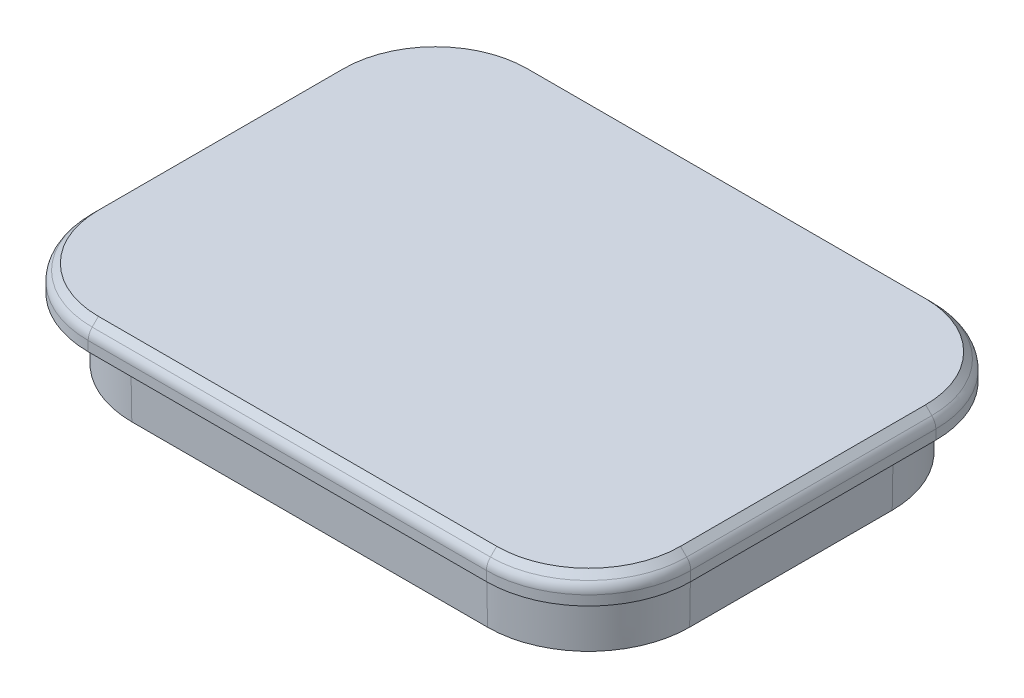
from build123d import *

# Parameters (mm, degrees)
BOSS_EXTRUDE1_DEPTH = 3.6
BOSS_EXTRUDE2_DEPTH = 1.5
CUT_EXTRUDE1_DEPTH  = 3.6
BOSS_EXTRUDE5_DEPTH = 3.6
CHAMFER1_SIZE       = 3.6
CHAMFER1_SIZE_2     = 0.062838234
FILLET3_R           = 1
CHAMFER2_SIZE       = 0.6
FILLET4_R           = 0.8


with BuildPart() as part:
    # Sketch1 → Boss-Extrude1 (new body)
    with BuildSketch(Plane(origin=(0, 0, 0), x_dir=(1, 0, 0), z_dir=(0, 1, 0))):
        with BuildLine():
            Line((6, 0), (26.9, 0))
            ThreePointArc((26.9, 0), (31.142640687, 1.757359313), (32.9, 6))
            Line((32.9, 6), (32.9, 17.9))
            ThreePointArc((32.9, 17.9), (31.142640687, 22.142640687), (26.9, 23.9))
            Line((26.9, 23.9), (6, 23.9))
            ThreePointArc((6, 23.9), (1.757359313, 22.142640687), (0, 17.9))
            Line((0, 17.9), (0, 6))
            ThreePointArc((0, 6), (1.757359313, 1.757359313), (6, 0))
        make_face()
    extrude(amount=BOSS_EXTRUDE1_DEPTH)

    # Sketch2 → Boss-Extrude2 (add)
    with BuildSketch(Plane(origin=(0, 3.6, 0), x_dir=(1, 0, 0), z_dir=(0, 1, 0))):
        with BuildLine():
            Line((4.75, 25.15), (28.15, 25.15))
            ThreePointArc((28.15, 25.15), (32.392640687, 23.392640687), (34.15, 19.15))
            Line((34.15, 19.15), (34.15, 4.75))
            ThreePointArc((34.15, 4.75), (32.392640687, 0.507359313), (28.15, -1.25))
            Line((28.15, -1.25), (4.75, -1.25))
            ThreePointArc((4.75, -1.25), (0.507359313, 0.507359313), (-1.25, 4.75))
            Line((-1.25, 4.75), (-1.25, 19.15))
            ThreePointArc((-1.25, 19.15), (0.507359313, 23.392640687), (4.75, 25.15))
        make_face()
    extrude(amount=BOSS_EXTRUDE2_DEPTH)

    # Sketch3 → Cut-Extrude1 (cut)
    with BuildSketch(Plane.XZ):
        with BuildLine():
            Line((25.7, -22.7), (7.2, -22.7))
            ThreePointArc((7.2, -22.7), (2.957359313, -20.942640687), (1.2, -16.7))
            Line((1.2, -16.7), (1.2, -7.2))
            ThreePointArc((1.2, -7.2), (2.957359313, -2.957359313), (7.2, -1.2))
            Line((7.2, -1.2), (25.7, -1.2))
            ThreePointArc((25.7, -1.2), (29.942640687, -2.957359313), (31.7, -7.2))
            Line((31.7, -7.2), (31.7, -16.7))
            ThreePointArc((31.7, -16.7), (29.942640687, -20.942640687), (25.7, -22.7))
        make_face()
    extrude(amount=-CUT_EXTRUDE1_DEPTH, mode=Mode.SUBTRACT)

    # Sketch5 → Boss-Extrude5 (add)
    with BuildSketch(Plane.XZ.offset(-3.6)):
        with BuildLine():
            Line((7.2, -1.2), (8.4, -1.2))
            Line((8.4, -1.2), (8.4, -6.2))
            ThreePointArc((8.4, -6.2), (8.692893219, -6.907106781), (9.4, -7.2))
            Line((9.4, -7.2), (23.5, -7.2))
            ThreePointArc((23.5, -7.2), (24.207106781, -6.907106781), (24.5, -6.2))
            Line((24.5, -6.2), (24.5, -1.2))
            Line((24.5, -1.2), (25.7, -1.2))
            Line((25.7, -1.2), (25.7, -6.2))
            ThreePointArc((25.7, -6.2), (25.992893219, -6.907106781), (26.7, -7.2))
            Line((26.7, -7.2), (31.7, -7.2))
            Line((31.7, -7.2), (31.7, -8.4))
            Line((31.7, -8.4), (26.7, -8.4))
            ThreePointArc((26.7, -8.4), (25.992893219, -8.692893219), (25.7, -9.4))
            Line((25.7, -9.4), (25.7, -14.5))
            ThreePointArc((25.7, -14.5), (25.992893219, -15.207106781), (26.7, -15.5))
            Line((26.7, -15.5), (31.7, -15.5))
            Line((31.7, -15.5), (31.7, -16.7))
            Line((31.7, -16.7), (26.7, -16.7))
            ThreePointArc((26.7, -16.7), (25.992893219, -16.992893219), (25.7, -17.7))
            Line((25.7, -17.7), (25.7, -22.7))
            Line((25.7, -22.7), (24.5, -22.7))
            Line((24.5, -22.7), (24.5, -17.7))
            ThreePointArc((24.5, -17.7), (24.207106781, -16.992893219), (23.5, -16.7))
            Line((23.5, -16.7), (9.4, -16.7))
            ThreePointArc((9.4, -16.7), (8.692893219, -16.992893219), (8.4, -17.7))
            Line((8.4, -17.7), (8.4, -22.7))
            Line((8.4, -22.7), (7.2, -22.7))
            Line((7.2, -22.7), (7.2, -17.7))
            ThreePointArc((7.2, -17.7), (6.907106781, -16.992893219), (6.2, -16.7))
            Line((6.2, -16.7), (1.2, -16.7))
            Line((1.2, -16.7), (1.2, -15.5))
            Line((1.2, -15.5), (6.2, -15.5))
            ThreePointArc((6.2, -15.5), (6.907106781, -15.207106781), (7.2, -14.5))
            Line((7.2, -14.5), (7.2, -9.4))
            ThreePointArc((7.2, -9.4), (6.907106781, -8.692893219), (6.2, -8.4))
            Line((6.2, -8.4), (1.2, -8.4))
            Line((1.2, -8.4), (1.2, -7.2))
            Line((1.2, -7.2), (6.2, -7.2))
            ThreePointArc((6.2, -7.2), (6.907106781, -6.907106781), (7.2, -6.2))
            Line((7.2, -6.2), (7.2, -1.2))
        make_face()
        with BuildLine():
            Line((9.4, -8.4), (23.5, -8.4))
            ThreePointArc((23.5, -8.4), (24.207106781, -8.692893219), (24.5, -9.4))
            Line((24.5, -9.4), (24.5, -14.5))
            ThreePointArc((24.5, -14.5), (24.207106781, -15.207106781), (23.5, -15.5))
            Line((23.5, -15.5), (9.4, -15.5))
            ThreePointArc((9.4, -15.5), (8.692893219, -15.207106781), (8.4, -14.5))
            Line((8.4, -14.5), (8.4, -9.4))
            ThreePointArc((8.4, -9.4), (8.692893219, -8.692893219), (9.4, -8.4))
        make_face(mode=Mode.SUBTRACT)
    extrude(amount=BOSS_EXTRUDE5_DEPTH)

    # Chamfer1
    # the kernel refuses this chamfer: 3.6, 0.062838234 mm, written as the material it takes off along each edge
    with BuildSketch(Plane(origin=(0, 0, -17.9), x_dir=(-0.0006712501823120534, 0.9999997747115711, 0), z_dir=(0, 0, 1))) as chamfer1_piece_1_section:
        Polygon((CHAMFER1_SIZE * 0.999999774712, -CHAMFER1_SIZE * 0.000671250182312), (-CHAMFER1_SIZE_2 * 0.000671250179552, -CHAMFER1_SIZE_2 * 0.999999770599), (0, 0), align=None)
    chamfer1_piece_1 = extrude(amount=11.9, mode=Mode.PRIVATE)
    chamfer1_piece_1 = split(chamfer1_piece_1, bisect_by=Plane(origin=(-0.01902042, 3.6, -11.95), z_dir=(0, -1, 0)), keep=Keep.TOP, mode=Mode.PRIVATE)
    add(chamfer1_piece_1, mode=Mode.SUBTRACT)
    with BuildSketch(Plane(origin=(6, 0, -6), x_dir=(-1, 0, 0), z_dir=(0, 0, -1))) as chamfer1_piece_2_section:
        Polygon((6, CHAMFER1_SIZE), (6 - CHAMFER1_SIZE_2 * 0.999999995888, 0), (6, 0), align=None)
    chamfer1_piece_2 = revolve(axis=Axis((6, 0, -6), (0, 1, 0)), revolution_arc=90, mode=Mode.PRIVATE)
    chamfer1_piece_2 = split(chamfer1_piece_2, bisect_by=Plane(origin=(1.769655981, 3.6, -1.769655981), z_dir=(0, -1, 0)), keep=Keep.TOP, mode=Mode.PRIVATE)
    add(chamfer1_piece_2, mode=Mode.SUBTRACT)
    with BuildSketch(Plane(origin=(6, 0, -17.9), x_dir=(0, 0, -1), z_dir=(1, 0, 0))) as chamfer1_piece_3_section:
        Polygon((6, CHAMFER1_SIZE), (6 - CHAMFER1_SIZE_2 * 0.999999995888, 0), (6, 0), align=None)
    chamfer1_piece_3 = revolve(axis=Axis((6, 0, -17.9), (0, 1, 0)), revolution_arc=90, mode=Mode.PRIVATE)
    chamfer1_piece_3 = split(chamfer1_piece_3, bisect_by=Plane(origin=(1.769655981, 3.6, -22.130344019), z_dir=(0, -1, 0)), keep=Keep.TOP, mode=Mode.PRIVATE)
    add(chamfer1_piece_3, mode=Mode.SUBTRACT)
    with BuildSketch(Plane(origin=(6, 0, 0), x_dir=(0, 0.9999997747115711, 0.0006712501823120534), z_dir=(1, 0, 0))) as chamfer1_piece_4_section:
        Polygon((CHAMFER1_SIZE * 0.999999774712, -CHAMFER1_SIZE * 0.000671250182312), (-CHAMFER1_SIZE_2 * 0.000671250179552, -CHAMFER1_SIZE_2 * 0.999999770599), (0, 0), align=None)
    chamfer1_piece_4 = extrude(amount=20.9, mode=Mode.PRIVATE)
    chamfer1_piece_4 = split(chamfer1_piece_4, bisect_by=Plane(origin=(16.45, 3.6, 0.01902042), z_dir=(0, -1, 0)), keep=Keep.TOP, mode=Mode.PRIVATE)
    add(chamfer1_piece_4, mode=Mode.SUBTRACT)
    with BuildSketch(Plane(origin=(26.9, 0, -23.9), x_dir=(0, 0.9999997747115711, -0.0006712501823119971), z_dir=(-1, 0, 0))) as chamfer1_piece_5_section:
        Polygon((CHAMFER1_SIZE * 0.999999774712, -CHAMFER1_SIZE * 0.000671250182312), (-CHAMFER1_SIZE_2 * 0.000671250179552, -CHAMFER1_SIZE_2 * 0.999999770599), (0, 0), align=None)
    chamfer1_piece_5 = extrude(amount=20.9, mode=Mode.PRIVATE)
    chamfer1_piece_5 = split(chamfer1_piece_5, bisect_by=Plane(origin=(16.45, 3.6, -23.91902042), z_dir=(0, -1, 0)), keep=Keep.TOP, mode=Mode.PRIVATE)
    add(chamfer1_piece_5, mode=Mode.SUBTRACT)
    with BuildSketch(Plane(origin=(26.9, 0, -6), x_dir=(0, 0, 1), z_dir=(-1, 0, 0))) as chamfer1_piece_6_section:
        Polygon((6, CHAMFER1_SIZE), (6 - CHAMFER1_SIZE_2 * 0.999999995888, 0), (6, 0), align=None)
    chamfer1_piece_6 = revolve(axis=Axis((26.9, 0, -6), (0, 1, 0)), revolution_arc=90, mode=Mode.PRIVATE)
    chamfer1_piece_6 = split(chamfer1_piece_6, bisect_by=Plane(origin=(31.130344019, 3.6, -1.769655981), z_dir=(0, -1, 0)), keep=Keep.TOP, mode=Mode.PRIVATE)
    add(chamfer1_piece_6, mode=Mode.SUBTRACT)
    with BuildSketch(Plane(origin=(26.9, 0, -17.9), x_dir=(1, 0, 0), z_dir=(0, 0, 1))) as chamfer1_piece_7_section:
        Polygon((6, CHAMFER1_SIZE), (6 - CHAMFER1_SIZE_2 * 0.999999995888, 0), (6, 0), align=None)
    chamfer1_piece_7 = revolve(axis=Axis((26.9, 0, -17.9), (0, 1, 0)), revolution_arc=90, mode=Mode.PRIVATE)
    chamfer1_piece_7 = split(chamfer1_piece_7, bisect_by=Plane(origin=(31.130344019, 3.6, -22.130344019), z_dir=(0, -1, 0)), keep=Keep.TOP, mode=Mode.PRIVATE)
    add(chamfer1_piece_7, mode=Mode.SUBTRACT)
    with BuildSketch(Plane(origin=(32.9, 0, -6), x_dir=(0.000671250182312946, 0.9999997747115711, 0), z_dir=(0, 0, -1))) as chamfer1_piece_8_section:
        Polygon((CHAMFER1_SIZE * 0.999999774712, -CHAMFER1_SIZE * 0.000671250182313), (-CHAMFER1_SIZE_2 * 0.000671250179553, -CHAMFER1_SIZE_2 * 0.999999770599), (0, 0), align=None)
    chamfer1_piece_8 = extrude(amount=11.9, mode=Mode.PRIVATE)
    chamfer1_piece_8 = split(chamfer1_piece_8, bisect_by=Plane(origin=(32.91902042, 3.6, -11.95), z_dir=(0, -1, 0)), keep=Keep.TOP, mode=Mode.PRIVATE)
    add(chamfer1_piece_8, mode=Mode.SUBTRACT)

    # Fillet3
    fillet3_edges = [part.edges().sort_by_distance(p)[0] for p in [
        (1.2, 1.8, -8.4),
        (1.2, 1.8, -15.5),
        (8.4, 1.8, -22.7),
        (24.5, 1.8, -22.7),
        (31.7, 1.8, -15.5),
        (31.7, 1.8, -8.4),
        (24.5, 1.8, -1.2),
        (8.4, 1.8, -1.2),
        (7.2, 1.8, -22.7),
        (1.2, 1.8, -16.7),
        (1.2, 1.8, -7.2),
        (7.2, 1.8, -1.2),
        (25.7, 1.8, -1.2),
        (31.7, 1.8, -7.2),
        (31.7, 1.8, -16.7),
        (25.7, 1.8, -22.7),
    ]]
    fillet(fillet3_edges, radius=FILLET3_R)

    # Chamfer2
    chamfer2_edges = [part.edges().sort_by_distance(p)[0] for p in [
        (0.507359313, 5.1, -0.507359313),
        (16.45, 5.1, 1.25),
        (32.392640687, 5.1, -0.507359313),
        (34.15, 5.1, -11.95),
        (32.392640687, 5.1, -23.392640687),
        (16.45, 5.1, -25.15),
        (0.507359313, 5.1, -23.392640687),
        (-1.25, 5.1, -11.95),
    ]]
    chamfer(chamfer2_edges, length=CHAMFER2_SIZE)

    # Fillet4
    fillet4_edges = [part.edges().sort_by_distance(p)[0] for p in [
        (16.45, 4.5, -25.15),
        (0.507359313, 4.5, -23.392640687),
        (32.392640687, 4.5, -23.392640687),
        (-1.25, 4.5, -11.95),
        (34.15, 4.5, -11.95),
        (0.507359313, 4.5, -0.507359313),
        (32.392640687, 4.5, -0.507359313),
        (16.45, 4.5, 1.25),
    ]]
    fillet(fillet4_edges, radius=FILLET4_R)


solid = part.part
